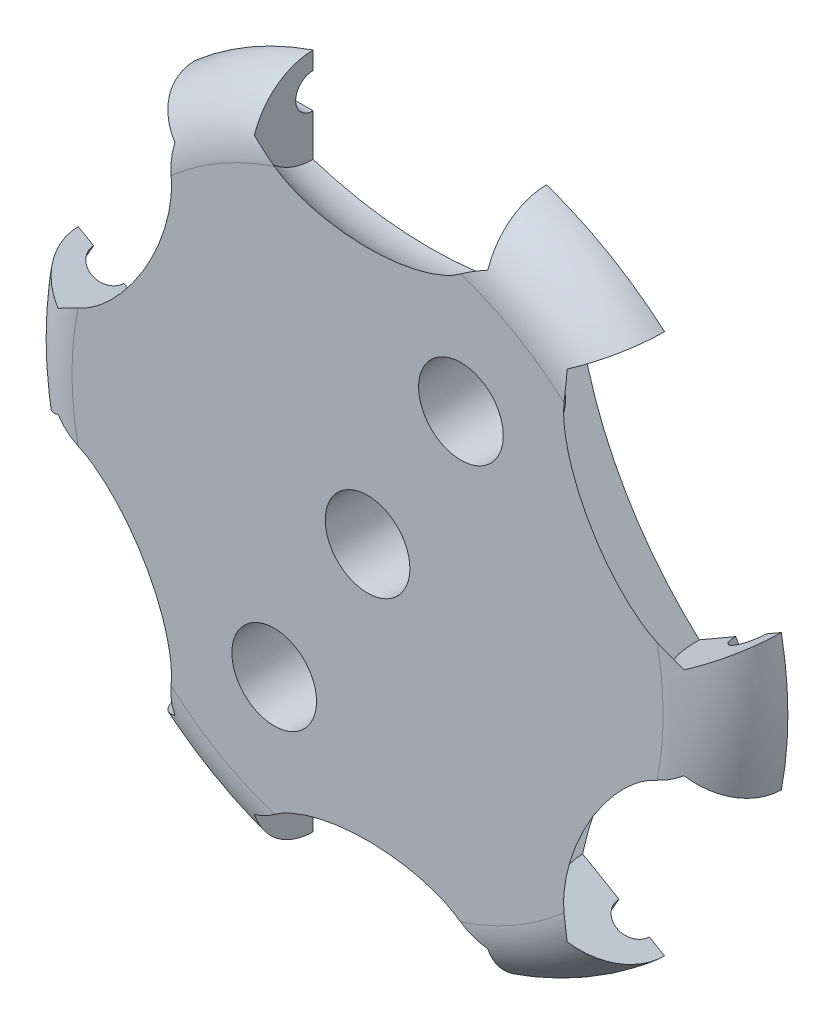
from build123d import *

# Parameters (mm, degrees)
SKETCH1_R           = 18.2626
BOSS_EXTRUDE1_DEPTH = 3.175
FILLET1_R           = 3.18516
SKETCH2_R           = 2.159
CUT_EXTRUDE1_DEPTH  = 27.021617144
SKETCH6_R           = 0.889
CUT_EXTRUDE2_DEPTH  = 7.9375
CIRPATTERN1_COUNT   = 6


with BuildPart() as part:
    # Sketch1 → Boss-Extrude1 (new body)
    with BuildSketch(Plane.XY):
        Circle(SKETCH1_R)
    extrude(amount=BOSS_EXTRUDE1_DEPTH)

    # Fillet1
    # the kernel refuses this fillet: 3.18516 mm, written as the material it takes off along each edge
    with BuildSketch(Plane(origin=(0, 0, 3.175), x_dir=(1, 0, 0), z_dir=(0, -1, 0))) as fillet1_piece_1:
        with BuildLine():
            CenterArc((18.2626 - FILLET1_R, -FILLET1_R), FILLET1_R, 0, 90)
            Line((18.2626 - FILLET1_R, 0), (18.2626, 0))
            Line((18.2626, 0), (18.2626, -FILLET1_R))
        make_face()
    revolve(axis=Axis((0, 0, 3.175), (0, 0, 1)), mode=Mode.SUBTRACT)

    # Sketch2 → Cut-Extrude1 (cut, through all)
    with BuildSketch(Plane.XY.offset(3.175)):
        with Locations((4.7625, 8.248891971)):
            Circle(SKETCH2_R)
        with Locations((-4.7625, -8.248891971)):
            Circle(SKETCH2_R)
        Circle(SKETCH2_R)
    extrude(amount=-CUT_EXTRUDE1_DEPTH, mode=Mode.SUBTRACT)

    # Sketch5 → Cut-Revolve1 (revolve, cut)
    with BuildSketch(Plane.XY):
        with BuildLine():
            Line((-5.953125, 15.4686), (5.953125, 15.4686))
            Line((5.953125, 15.4686), (5.953125, 18.503266678))
            ThreePointArc((5.953125, 18.503266678), (0, 19.43735), (-5.953125, 18.503266678))
            Line((-5.953125, 18.503266678), (-5.953125, 15.4686))
        make_face()
    cut_revolve1 = revolve(axis=Axis((-5.953125, 15.4686, 0), (-1, 0, 0)), mode=Mode.SUBTRACT)

    # Sketch6 → Cut-Extrude2 (cut, symmetric)
    with BuildSketch(Plane(origin=(0, 0, 0), x_dir=(0, 0, -1), z_dir=(1, 0, 0))):
        with Locations((0, 15.4686)):
            Circle(SKETCH6_R)
    cut_extrude2 = extrude(amount=CUT_EXTRUDE2_DEPTH, both=True, mode=Mode.SUBTRACT)

    # CirPattern1: Cut-Revolve1, Cut-Extrude2 ×6 about axis
    cirpattern1_axis = Axis((0, 0, 0), (0, 0, 1))
    add([cut_revolve1.rotate(cirpattern1_axis, i * 360 / CIRPATTERN1_COUNT) for i in range(1, CIRPATTERN1_COUNT)], mode=Mode.SUBTRACT)
    add([cut_extrude2.rotate(cirpattern1_axis, i * 360 / CIRPATTERN1_COUNT) for i in range(1, CIRPATTERN1_COUNT)], mode=Mode.SUBTRACT)


solid = part.part
